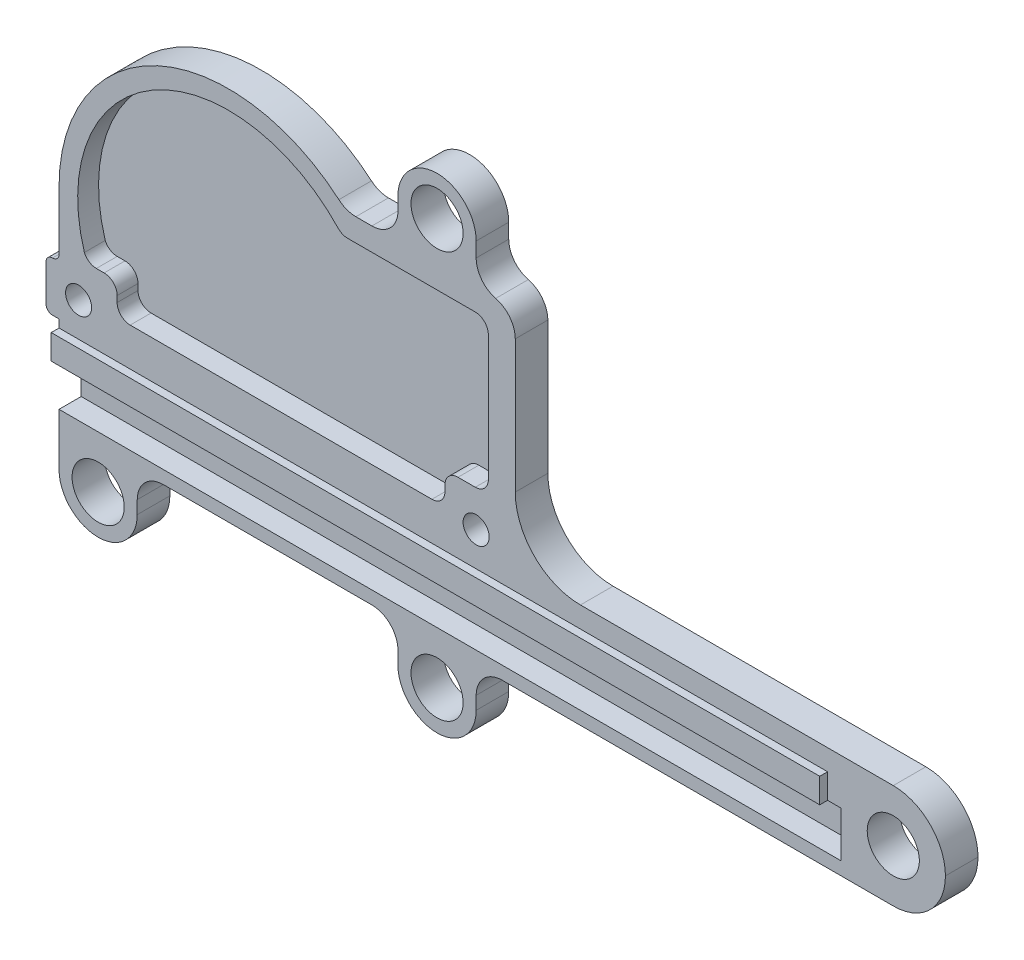
from build123d import *

# Parameters (mm, degrees)
AUFSATZ_LINEAR_AUSTRAGEN1_DEPTH = 2.5
VERRUNDUNG1_R                   = 2
VERRUNDUNG2_R                   = 5
SKIZZE2_W                       = 60
SKIZZE2_H                       = 6
SCHNITT_LINEAR_AUSTRAGEN1_DEPTH = 1.7
SKIZZE3_W                       = 60
SKIZZE3_H                       = 2.5
AUFSATZ_LINEAR_AUSTRAGEN3_DEPTH = 2.3
SKIZZE5_R                       = 1
SCHNITT_LINEAR_AUSTRAGEN3_DEPTH = 2.5
SKIZZE6_R                       = 1
SCHNITT_LINEAR_AUSTRAGEN4_DEPTH = 2.5
SKIZZE7_W                       = 8
SKIZZE7_H                       = 8
SKIZZE7_R                       = 2
AUFSATZ_LINEAR_AUSTRAGEN4_DEPTH = 2.5
VERRUNDUNG3_R                   = 4
SKIZZE8_W                       = 1.041077985
SKIZZE8_H                       = 2.5
SCHNITT_LINEAR_AUSTRAGEN5_DEPTH = 0.6
SKIZZE10_W                      = 58.958922015
SKIZZE10_H                      = 0.6
SCHNITT_LINEAR_AUSTRAGEN6_DEPTH = 0.6
SCHNITT_LINEAR_AUSTRAGEN7_DEPTH = 1.6
SKIZZESTUTZENINNEN_R            = 2
AUFSATZ_LINEAR_AUSTRAGEN5_DEPTH = 2.5
VERRUNDUNG4_R                   = 1
VERRUNDUNG5_R                   = 2
VERRUNDUNG6_R                   = 2
SKIZZE12_R                      = 2
AUFSATZ_LINEAR_AUSTRAGEN6_DEPTH = 2.5
VERRUNDUNG7_R                   = 2
SKIZZE13_W                      = 1
SKIZZE13_H                      = 3.8
AUFSATZ_LINEAR_AUSTRAGEN7_DEPTH = 2.5
VERRUNDUNG9_R                   = 0.5


# Some blends are built 0.0001 mm under size
with BuildPart() as part:
    # d-body → Aufsatz-Linear austragen1 (new body)
    with BuildSketch(Plane.XY):
        with BuildLine():
            Line((25.141766665, 0), (-34.858233335, 0))
            Line((-34.858233335, 0), (-34.858233335, 15.8))
            ThreePointArc((-34.858233335, 15.8), (-31.050621491, 24.992388155), (-21.858233335, 28.8))
            ThreePointArc((-21.858233335, 28.8), (-17.008017348, 27.861318538), (-12.858233335, 25.18083152))
            Line((-12.858233335, 25.18083152), (0.141766665, 25.18083152))
            Line((0.141766665, 25.18083152), (0.141766665, 8))
            Line((0.141766665, 8), (25.141766665, 8))
            Line((25.141766665, 8), (25.141766665, 0))
        make_face()
    extrude(amount=AUFSATZ_LINEAR_AUSTRAGEN1_DEPTH)

    # Verrundung1
    verrundung1_edges = [part.edges().sort_by_distance(p)[0] for p in [
        (0.141766665, 25.18083152, 1.25),
    ]]
    fillet(verrundung1_edges, radius=VERRUNDUNG1_R)

    # Verrundung2
    verrundung2_edges = [part.edges().sort_by_distance(p)[0] for p in [
        (0.141766665, 8, 1.25),
    ]]
    fillet(verrundung2_edges, radius=VERRUNDUNG2_R)

    # Skizze2 → Schnitt-Linear austragen1 (cut)
    with BuildSketch(Plane.XY.offset(2.5)):
        with Locations((-4.858233335, 4)):
            Rectangle(SKIZZE2_W, SKIZZE2_H)
    extrude(amount=-SCHNITT_LINEAR_AUSTRAGEN1_DEPTH, mode=Mode.SUBTRACT)

    # Skizze3 → Aufsatz-Linear austragen3 (add)
    with BuildSketch(Plane.XY.offset(0.8)):
        with Locations((-4.858233335, 5.75)):
            Rectangle(SKIZZE3_W, SKIZZE3_H)
    extrude(amount=AUFSATZ_LINEAR_AUSTRAGEN3_DEPTH)

    # Skizze5 → Schnitt-Linear austragen3 (cut)
    with BuildSketch(Plane(origin=(0, 0, 0), x_dir=(-1, 0, 0), z_dir=(0, 0, -1))):
        with Locations((33.358233335, 9)):
            Circle(SKIZZE5_R)
    extrude(amount=-SCHNITT_LINEAR_AUSTRAGEN3_DEPTH, mode=Mode.SUBTRACT)

    # Skizze6 → Schnitt-Linear austragen4 (cut)
    with BuildSketch(Plane(origin=(0, 0, 0), x_dir=(-1, 0, 0), z_dir=(0, 0, -1))):
        with Locations((2.858233335, 9)):
            Circle(SKIZZE6_R)
    extrude(amount=-SCHNITT_LINEAR_AUSTRAGEN4_DEPTH, mode=Mode.SUBTRACT)

    # Skizze7 → Aufsatz-Linear austragen4 (add)
    with BuildSketch(Plane(origin=(0, 0, 0), x_dir=(-1, 0, 0), z_dir=(0, 0, -1))):
        with Locations((-29.141766665, 4)):
            Rectangle(SKIZZE7_W, SKIZZE7_H)
        with Locations((-29.141766665, 4)):
            Circle(SKIZZE7_R, mode=Mode.SUBTRACT)
    extrude(amount=-AUFSATZ_LINEAR_AUSTRAGEN4_DEPTH)

    # Verrundung3
    verrundung3_edges = [part.edges().sort_by_distance(p)[0] for p in [
        (33.141766665, 0, 1.25),
        (33.141766665, 8, 1.25),
    ]]
    fillet(verrundung3_edges, radius=VERRUNDUNG3_R - 0.0001)  # a hair under: the kernel refuses the full size

    # Skizze8 → Schnitt-Linear austragen5 (cut)
    with BuildSketch(Plane.XY.offset(3.1)):
        with Locations((24.621227673, 5.75)):
            Rectangle(SKIZZE8_W, SKIZZE8_H)
    extrude(amount=-SCHNITT_LINEAR_AUSTRAGEN5_DEPTH, mode=Mode.SUBTRACT)

    # Skizze10 → Schnitt-Linear austragen6 (cut)
    with BuildSketch(Plane.XY.offset(3.1)):
        with Locations((-5.378772328, 6.7)):
            Rectangle(SKIZZE10_W, SKIZZE10_H)
    extrude(amount=-SCHNITT_LINEAR_AUSTRAGEN6_DEPTH, mode=Mode.SUBTRACT)

    # Skizze11 → Schnitt-Linear austragen7 (cut)
    with BuildSketch(Plane.XY.offset(2.5)):
        with BuildLine():
            Line((-30.399734465, 9.324335962), (-5.252382746, 9.324335962))
            Line((-5.252382746, 9.324335962), (-5.252382746, 11.789002727))
            Line((-5.252382746, 11.789002727), (-1.923745725, 11.789002727))
            Line((-1.923745725, 11.789002727), (-1.923745725, 23.431190429))
            Line((-1.923745725, 23.431190429), (-13.163081736, 23.431190429))
            ThreePointArc((-13.163081736, 23.431190429), (-27.503142881, 25.898303071), (-32.913464689, 12.390808249))
            Line((-32.913464689, 12.390808249), (-32.913464689, 11.789002727))
            Line((-32.913464689, 11.789002727), (-30.399734465, 11.789002727))
            Line((-30.399734465, 11.789002727), (-30.399734465, 9.324335962))
        make_face()
    extrude(amount=-SCHNITT_LINEAR_AUSTRAGEN7_DEPTH, mode=Mode.SUBTRACT)

    # SkizzeStutzenInnen → Aufsatz-Linear austragen5 (add)
    # profile 1 of 2: a face of its own
    with BuildSketch(Plane.XY.offset(2.5)):
        with BuildLine():
            Line((-8.858233335, 25.18083152), (-8.858233335, 28.18083152))
            ThreePointArc((-8.858233335, 28.18083152), (-5.858233335, 31.18083152), (-2.858233335, 28.18083152))
            Line((-2.858233335, 28.18083152), (-2.858233335, 25.18083152))
            Line((-2.858233335, 25.18083152), (-8.858233335, 25.18083152))
        make_face()
        with Locations((-5.858233335, 28.18083152)):
            Circle(SKIZZESTUTZENINNEN_R, mode=Mode.SUBTRACT)
    # profile 2 of 2: a face of its own
    with BuildSketch(Plane.XY.offset(2.5)):
        with BuildLine():
            Line((-8.858233335, 0), (-8.858233335, -3))
            ThreePointArc((-8.858233335, -3), (-5.858233335, -6), (-2.858233335, -3))
            Line((-2.858233335, -3), (-2.858233335, 0))
            Line((-2.858233335, 0), (-8.858233335, 0))
        make_face()
        with Locations((-5.858233335, -3)):
            Circle(SKIZZESTUTZENINNEN_R, mode=Mode.SUBTRACT)
    extrude(amount=-AUFSATZ_LINEAR_AUSTRAGEN5_DEPTH)

    # Verrundung4
    # the kernel refuses this fillet: 1 mm, written as the material it adds along each edge
    with BuildSketch(Plane(origin=(-1.923745725, 23.431190429, 2.5), x_dir=(-1, 0, 0), z_dir=(0, 0, -1)), Plane(origin=(-1.923745725, 11.789002727, 2.5), x_dir=(0, 1, 0), z_dir=(0, 0, -1)), Plane(origin=(-5.252382746, 9.324335962, 2.5), x_dir=(0, 1, 0), z_dir=(0, 0, -1))) as verrundung4_piece_1:
        with BuildLine():
            CenterArc((VERRUNDUNG4_R, -VERRUNDUNG4_R), VERRUNDUNG4_R, 90, 90)
            Line((0, -VERRUNDUNG4_R), (0, 0))
            Line((0, 0), (VERRUNDUNG4_R, 0))
        make_face()
    extrude(amount=1.6)
    with BuildSketch(Plane(origin=(-32.913464689, 11.789002727, 2.5), x_dir=(1, 0, 0), z_dir=(0, 0, -1))) as verrundung4_piece_2:
        with BuildLine():
            CenterArc((0.917301018, -1), VERRUNDUNG4_R, 90, 66.534645017)
            Line((0, -0.601805522), (0, 0))
            Line((0, 0), (0.917301018, 0))
        make_face()
    extrude(amount=1.6)
    with BuildSketch(Plane(origin=(-30.399734465, 9.324335962, 2.5), x_dir=(0, 1, 0), z_dir=(0, 0, -1))) as verrundung4_piece_3:
        with BuildLine():
            CenterArc((VERRUNDUNG4_R, VERRUNDUNG4_R), VERRUNDUNG4_R, 180, 90)
            Line((0, VERRUNDUNG4_R), (0, 0))
            Line((0, 0), (VERRUNDUNG4_R, 0))
        make_face()
    extrude(amount=1.6)
    # the kernel refuses this fillet: 1 mm, written as the material it takes off along each edge
    with BuildSketch(Plane(origin=(-13.163081736, 23.431190429, 3.604131537), x_dir=(1, 0, 0), z_dir=(0, 0, -1))) as verrundung4_2_piece_1:
        with BuildLine():
            CenterArc((0.441652615, -1), VERRUNDUNG4_R, 90, 46.62999375)
            ThreePointArc((-0.28528164, -0.313292938), (-0.141206384, -0.157952653), (0, 0))
            Line((0, 0), (0.441652615, 0))
        make_face()
    extrude(amount=2.704131537, mode=Mode.SUBTRACT)
    with BuildSketch(Plane(origin=(-30.399734465, 11.789002727, 5), x_dir=(0, -1, 0), z_dir=(0, 0, -1))) as verrundung4_2_piece_2:
        with BuildLine():
            CenterArc((VERRUNDUNG4_R, VERRUNDUNG4_R), VERRUNDUNG4_R, 180, 90)
            Line((0, VERRUNDUNG4_R), (0, 0))
            Line((0, 0), (VERRUNDUNG4_R, 0))
        make_face()
    extrude(amount=4.1, mode=Mode.SUBTRACT)
    with BuildSketch(Plane(origin=(-5.252382746, 11.789002727, 5), x_dir=(0, -1, 0), z_dir=(0, 0, -1))) as verrundung4_2_piece_3:
        with BuildLine():
            CenterArc((VERRUNDUNG4_R, -VERRUNDUNG4_R), VERRUNDUNG4_R, 90, 90)
            Line((0, -VERRUNDUNG4_R), (0, 0))
            Line((0, 0), (VERRUNDUNG4_R, 0))
        make_face()
    extrude(amount=4.1, mode=Mode.SUBTRACT)

    # Verrundung5
    verrundung5_edges = [part.edges().sort_by_distance(p)[0] for p in [
        (-8.858233335, 0, 1.25),
        (-2.858233335, 0, 1.25),
        (-2.858233335, 25.18083152, 1.25),
        (-8.858233335, 25.18083152, 1.25),
    ]]
    fillet(verrundung5_edges, radius=VERRUNDUNG5_R)

    # Verrundung6
    verrundung6_edges = [part.edges().sort_by_distance(p)[0] for p in [
        (-12.858233335, 25.18083152, 1.25),
    ]]
    fillet(verrundung6_edges, radius=VERRUNDUNG6_R)

    # Skizze12 → Aufsatz-Linear austragen6 (add)
    with BuildSketch(Plane(origin=(0, 0, 0), x_dir=(-1, 0, 0), z_dir=(0, 0, -1))):
        with BuildLine():
            Line((28.858233335, 0), (34.858233335, 0))
            Line((34.858233335, 0), (34.858233335, -3))
            ThreePointArc((34.858233335, -3), (31.858233335, -6), (28.858233335, -3))
            Line((28.858233335, -3), (28.858233335, 0))
        make_face()
        with Locations((31.858233335, -3)):
            Circle(SKIZZE12_R, mode=Mode.SUBTRACT)
    extrude(amount=-AUFSATZ_LINEAR_AUSTRAGEN6_DEPTH)

    # Verrundung7
    verrundung7_edges = [part.edges().sort_by_distance(p)[0] for p in [
        (-28.858233335, 0, 1.25),
    ]]
    fillet(verrundung7_edges, radius=VERRUNDUNG7_R)

    # Skizze13 → Aufsatz-Linear austragen7 (add)
    with BuildSketch(Plane(origin=(0, 0, 0), x_dir=(-1, 0, 0), z_dir=(0, 0, -1))):
        with Locations((35.358233335, 8.9)):
            Rectangle(SKIZZE13_W, SKIZZE13_H)
    extrude(amount=-AUFSATZ_LINEAR_AUSTRAGEN7_DEPTH)

    # Verrundung9
    verrundung9_edges = [part.edges().sort_by_distance(p)[0] for p in [
        (-34.858233335, 10.8, 1.25),
        (-35.858233335, 7, 1.25),
        (-35.858233335, 10.8, 1.25),
    ]]
    fillet(verrundung9_edges, radius=VERRUNDUNG9_R - 0.0001)  # a hair under: the kernel refuses the full size


solid = part.part
